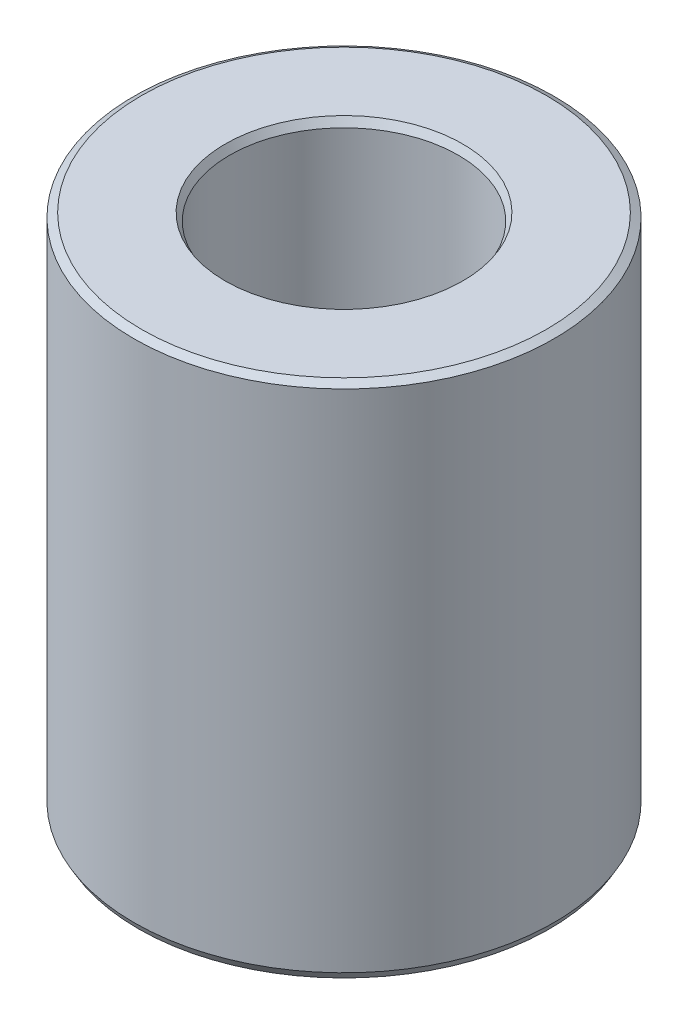
from build123d import *
from OCP.BRepFilletAPI import BRepFilletAPI_MakeChamfer

# Parameters (mm, degrees)
SKETCH1_R           = 17.5
BOSS_EXTRUDE1_DEPTH = 43.110593332
SKETCH2_R           = 9.531521225
CUT_EXTRUDE1_DEPTH  = 50.709388021
CHAMFER1_SIZE       = 0.361410203
CHAMFER1_SIZE2      = 0.630582235


with BuildPart() as part:
    # Sketch1 → Boss-Extrude1 (new body)
    with BuildSketch(Plane(origin=(0, 0, 0), x_dir=(1, 0, 0), z_dir=(0, 1, 0))):
        Circle(SKETCH1_R)
    extrude(amount=BOSS_EXTRUDE1_DEPTH)

    # Sketch2 → Cut-Extrude1 (cut, through all)
    with BuildSketch(Plane(origin=(0, 0, 0), x_dir=(1, 0, 0), z_dir=(0, 1, 0))):
        Circle(SKETCH2_R)
    extrude(amount=CUT_EXTRUDE1_DEPTH, mode=Mode.SUBTRACT)

    # Chamfer1: one chamfer whose edges measure the first distance from different faces: ONE call of the kernel's chamfer builder (chamfer() names one face for all edges)
    chamfer1_edges_1 = [part.edges().sort_by_distance(p)[0] for p in [
        (-9.531521225, 43.110593332, 0),
    ]]
    chamfer1_side_1 = [part.faces().sort_by_distance(p)[0] for p in [
        (-17.005025253, 43.110593332, 0),
    ]]
    chamfer1_edges_2 = [part.edges().sort_by_distance(p)[0] for p in [
        (-9.531521225, 0, 0),
    ]]
    chamfer1_side_2 = [part.faces().sort_by_distance(p)[0] for p in [
        (-9.531521225, 21.555296666, 0),
    ]]
    chamfer1_edges_3 = [part.edges().sort_by_distance(p)[0] for p in [
        (-17.5, 0, 0),
    ]]
    chamfer1_side_3 = [part.faces().sort_by_distance(p)[0] for p in [
        (-17.005025253, 0, 0),
    ]]
    chamfer1_edges_4 = [part.edges().sort_by_distance(p)[0] for p in [
        (-17.5, 43.110593332, 0),
    ]]
    chamfer1_side_4 = [part.faces().sort_by_distance(p)[0] for p in [
        (-17.5, 21.555296666, 0),
    ]]
    chamfer1 = BRepFilletAPI_MakeChamfer(part.part.solid().wrapped)
    for e in chamfer1_edges_1:
        chamfer1.Add(CHAMFER1_SIZE, CHAMFER1_SIZE2, e.wrapped, chamfer1_side_1[0].wrapped)  # the first distance lies on this face
    for e in chamfer1_edges_2:
        chamfer1.Add(CHAMFER1_SIZE, CHAMFER1_SIZE2, e.wrapped, chamfer1_side_2[0].wrapped)  # the first distance lies on this face
    for e in chamfer1_edges_3:
        chamfer1.Add(CHAMFER1_SIZE, CHAMFER1_SIZE2, e.wrapped, chamfer1_side_3[0].wrapped)  # the first distance lies on this face
    for e in chamfer1_edges_4:
        chamfer1.Add(CHAMFER1_SIZE, CHAMFER1_SIZE2, e.wrapped, chamfer1_side_4[0].wrapped)  # the first distance lies on this face
    add(Compound.cast(chamfer1.Shape()), mode=Mode.REPLACE)


solid = part.part
